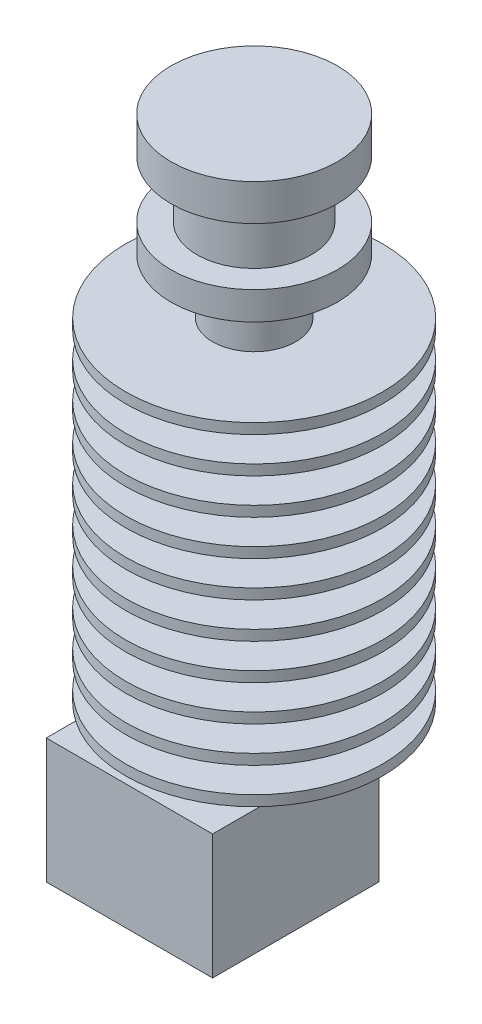
from build123d import *

# Parameters (mm, degrees)
ESBO_O3_W                = 16
ESBO_O3_H                = 16
RESSALTO_EXTRUS_O1_DEPTH = 12
ESBO_O4_R                = 3
RESSALTO_EXTRUS_O2_DEPTH = 5
RESSALTO_EXTRUS_O2_TAPER = 26


with BuildPart() as part:
    # Esboço1 → Revolução1 (revolve)
    with BuildSketch(Plane.XY):
        Polygon((0, 51.659238703), (0, 1.659238703), (2, 1.659238703), (2, 2.659238703), (12.35, 2.659238703), (12.35, 3.659238703), (4, 3.659238703), (4, 6.103683147), (12.35, 6.103683147), (12.35, 7.103683147), (4, 7.103683147), (4, 9.548127592), (12.35, 9.548127592), (12.35, 10.548127592), (4, 10.548127592), (4, 12.992572036), (12.35, 12.992572036), (12.35, 13.992572036), (4, 13.992572036), (4, 16.437016481), (12.35, 16.437016481), (12.35, 17.437016481), (4, 17.437016481), (4, 19.881460925), (12.35, 19.881460925), (12.35, 20.881460925), (4, 20.881460925), (4, 23.32590537), (12.35, 23.32590537), (12.35, 24.32590537), (4, 24.32590537), (4, 26.770349814), (12.35, 26.770349814), (12.35, 27.770349814), (4, 27.770349814), (4, 30.214794259), (12.35, 30.214794259), (12.35, 31.214794259), (4, 31.214794259), (4, 33.659238703), (12.35, 33.659238703), (12.35, 34.659238703), (4, 34.659238703), (4, 39.959238703), (8, 39.959238703), (8, 42.659238703), (5.5, 42.659238703), (5.5, 48.159238703), (8, 48.159238703), (8, 51.659238703), align=None)
    revolve(axis=Axis((0, 51.659238703, 0), (0, -1, 0)))

    # Esboço3 → Ressalto-extrusão1 (add)
    with BuildSketch(Plane.XZ.offset(-1.659238703)):
        with Locations((0, 4)):
            Rectangle(ESBO_O3_W, ESBO_O3_H)
    extrude(amount=RESSALTO_EXTRUS_O1_DEPTH)

    # Esboço4 → Ressalto-extrusão2 (add)
    with BuildSketch(Plane.XZ.offset(10.340761297)):
        Circle(ESBO_O4_R)
    extrude(amount=RESSALTO_EXTRUS_O2_DEPTH, taper=RESSALTO_EXTRUS_O2_TAPER)


solid = part.part
